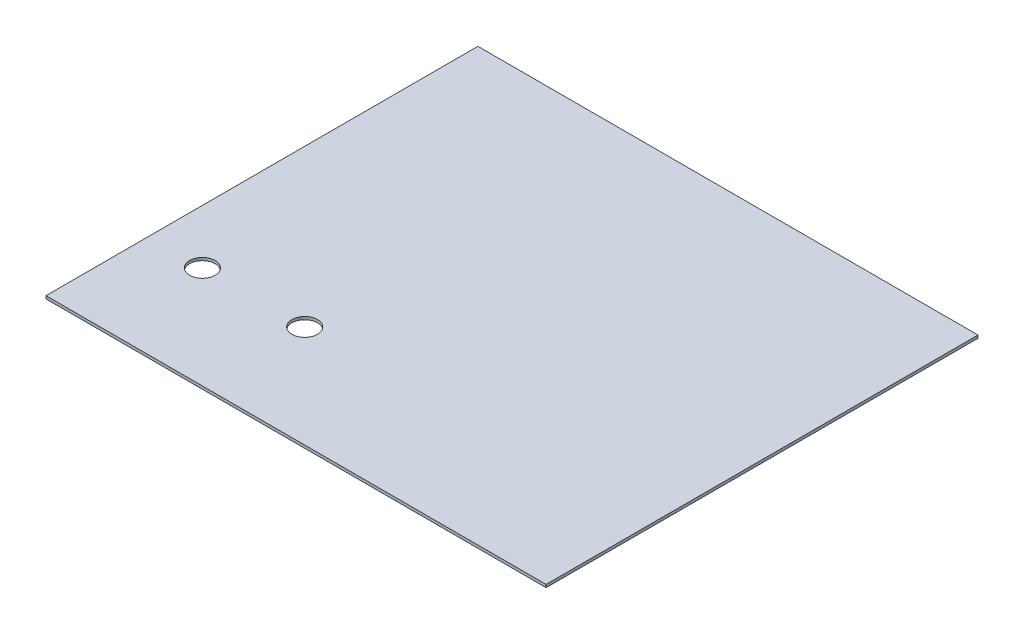
from build123d import *

# Parameters (mm, degrees)
SKETCH1_W           = 558.8
SKETCH1_H           = 482.6
BOSS_EXTRUDE1_DEPTH = 3.175
SKETCH2_R           = 14.2875
CUT_EXTRUDE1_DEPTH  = 3.175


with BuildPart() as part:
    # Sketch1 → Boss-Extrude1 (new body)
    with BuildSketch(Plane(origin=(0, 0, 0), x_dir=(1, 0, 0), z_dir=(0, 1, 0))):
        with Locations((279.4, 241.3)):
            Rectangle(SKETCH1_W, SKETCH1_H)
    extrude(amount=BOSS_EXTRUDE1_DEPTH)

    # Sketch2 → Cut-Extrude1 (cut)
    with BuildSketch(Plane(origin=(0, 3.175, 0), x_dir=(1, 0, 0), z_dir=(0, 1, 0))):
        with Locations((60.460569695, 114.3)):
            Circle(SKETCH2_R)
        with Locations((174.760569695, 114.3)):
            Circle(SKETCH2_R)
    extrude(amount=-CUT_EXTRUDE1_DEPTH, mode=Mode.SUBTRACT)


solid = part.part
